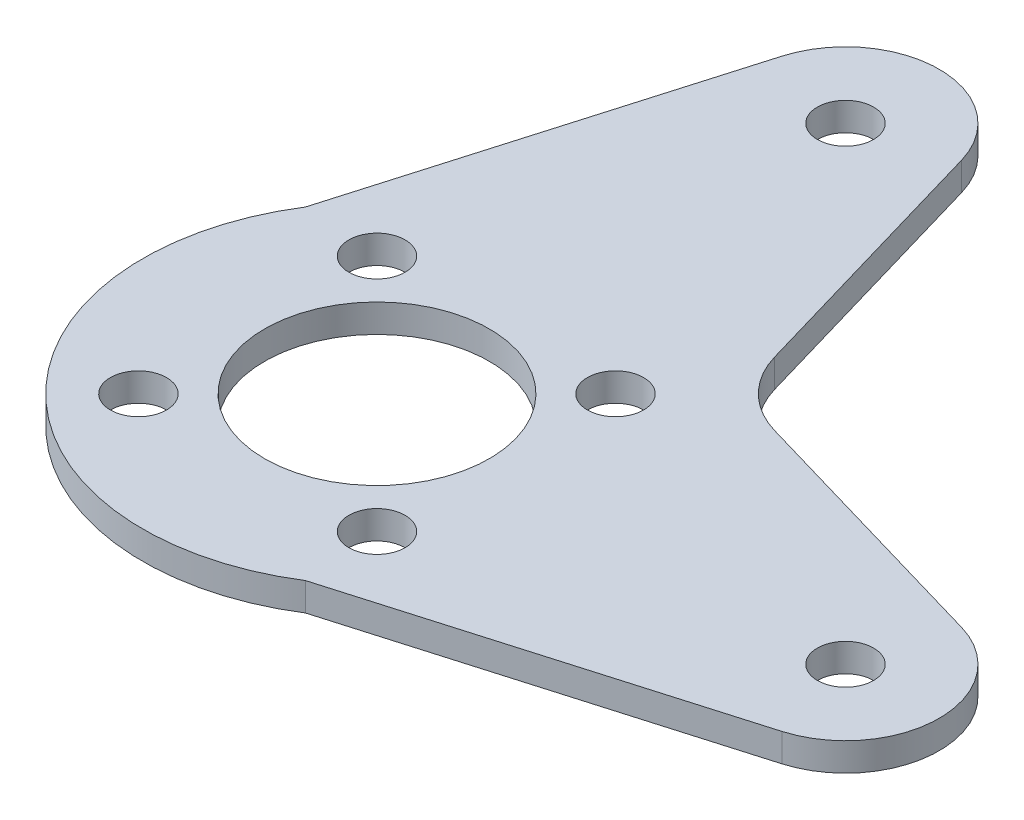
from build123d import *

# Parameters (mm, degrees)
SZKIC1_R                    = 3
SZKIC1_R_2                  = 12
DODANIE_WYCI_GNI_CIE1_DEPTH = 3


with BuildPart() as part:
    # Szkic1 → Dodanie-wyciągnięcie1 (new body)
    with BuildSketch(Plane(origin=(0, 0, 0), x_dir=(1, 0, 0), z_dir=(0, 1, 0))):
        with BuildLine():
            Line((13.44, -21.08), (52.8, -9.6))
            ThreePointArc((52.8, -9.6), (60, 0), (52.8, 9.6))
            Line((52.8, 9.6), (24.619354839, 17.819354839))
            ThreePointArc((24.619354839, 17.819354839), (20.348287027, 20.348287027), (17.819354839, 24.619354839))
            Line((17.819354839, 24.619354839), (9.6, 52.8))
            ThreePointArc((9.6, 52.8), (0, 60), (-9.6, 52.8))
            Line((-9.6, 52.8), (-21.08, 13.44))
            ThreePointArc((-21.08, 13.44), (-17.67766953, -17.67766953), (13.44, -21.08))
        make_face()
        with Locations((0, 50)):
            Circle(SZKIC1_R, mode=Mode.SUBTRACT)
        with Locations((-12.727922061, 12.727922061)):
            Circle(SZKIC1_R, mode=Mode.SUBTRACT)
        with Locations((-12.727922061, -12.727922061)):
            Circle(SZKIC1_R, mode=Mode.SUBTRACT)
        with Locations((12.727922061, -12.727922061)):
            Circle(SZKIC1_R, mode=Mode.SUBTRACT)
        with Locations((12.727922061, 12.727922061)):
            Circle(SZKIC1_R, mode=Mode.SUBTRACT)
        with Locations((50, 0)):
            Circle(SZKIC1_R, mode=Mode.SUBTRACT)
        Circle(SZKIC1_R_2, mode=Mode.SUBTRACT)
    extrude(amount=DODANIE_WYCI_GNI_CIE1_DEPTH)


solid = part.part
